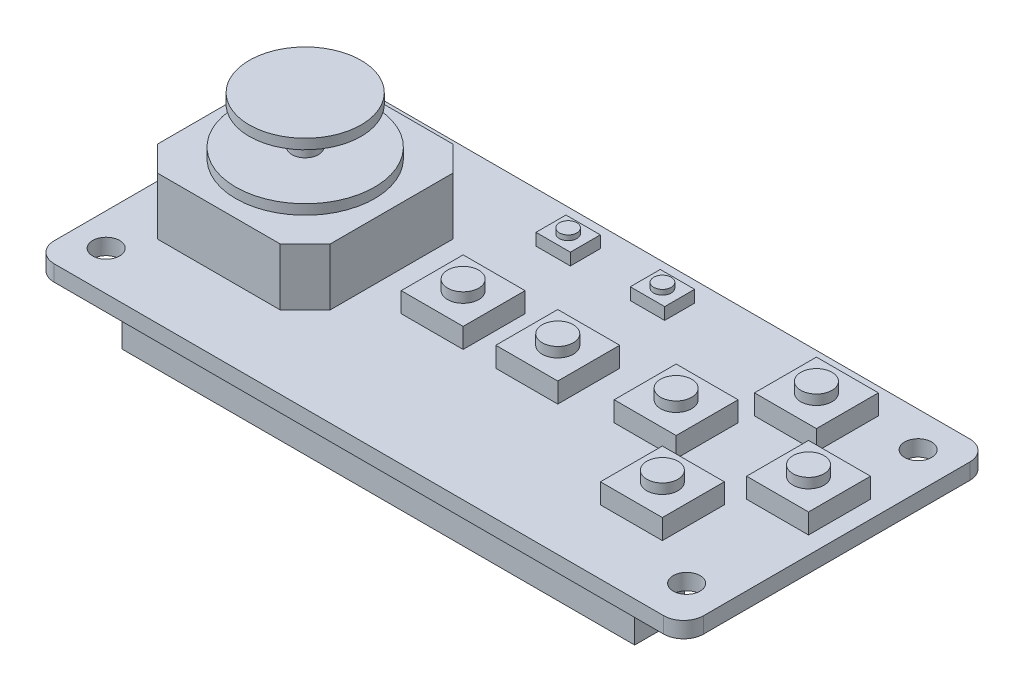
from build123d import *

# Parameters (mm, degrees)
SKETCH_1_W          = 65
SKETCH_1_H          = 30.64
EXTRUDE_1_DEPTH     = 1.6
FILLET_1_R          = 2
SKETCH_2_R          = 1.35
CUT_EXTRUDE_1_DEPTH = 1.6
SKETCH_3_W          = 51.3
SKETCH_3_H          = 5
EXTRUDE_2_DEPTH     = 4
SKETCH_4_W          = 17.3
SKETCH_4_H          = 17.3
EXTRUDE_3_DEPTH     = 5.72
CHAMFER_1_SIZE      = 2.5
SKETCH_5_R          = 6.95
EXTRUDE_4_DEPTH     = 1
SKETCH_6_R          = 1.326147724
EXTRUDE_5_DEPTH     = 3.72
SKETCH_7_R          = 5.6
EXTRUDE_6_DEPTH     = 1
SKETCH_8_W          = 6.2
SKETCH_8_H          = 6.2
EXTRUDE_7_DEPTH     = 2
SKETCH_9_R          = 1.56
EXTRUDE_8_DEPTH     = 1
SKETCH_10_W         = 3.44
SKETCH_10_H         = 3
EXTRUDE_9_DEPTH     = 1.2
SKETCH_11_R         = 0.875
EXTRUDE_10_DEPTH    = 0.5


with BuildPart() as part:
    # 草图1 → 凸台-拉伸1 (new body)
    with BuildSketch(Plane(origin=(0, 0, 0), x_dir=(1, 0, 0), z_dir=(0, 1, 0))):
        with Locations((-2.796247961, 2.767463295)):
            Rectangle(SKETCH_1_W, SKETCH_1_H)
    extrude(amount=EXTRUDE_1_DEPTH)

    # 圆角1
    fillet_1_edges = [part.edges().sort_by_distance(p)[0] for p in [
        (-35.296247961, 0.8, -18.087463295),
        (-35.296247961, 0.8, 12.552536705),
        (29.703752039, 0.8, -18.087463295),
        (29.703752039, 0.8, 12.552536705),
    ]]
    fillet(fillet_1_edges, radius=FILLET_1_R)

    # 草图2 → 切除-拉伸1 (cut)
    with BuildSketch(Plane(origin=(0, 1.6, 0), x_dir=(1, 0, 0), z_dir=(0, 1, 0))):
        with Locations((-32.046247961, 14.567463295)):
            Circle(SKETCH_2_R)
        with Locations((26.053752039, 14.567463295)):
            Circle(SKETCH_2_R)
        with Locations((26.053752039, -8.602536705)):
            Circle(SKETCH_2_R)
        with Locations((-32.046247961, -8.602536705)):
            Circle(SKETCH_2_R)
    extrude(amount=-CUT_EXTRUDE_1_DEPTH, mode=Mode.SUBTRACT)

    # 草图3 → 凸台-拉伸2 (add)
    with BuildSketch(Plane.XZ):
        with Locations((-2.446247961, 8.452536705)):
            Rectangle(SKETCH_3_W, SKETCH_3_H)
    extrude(amount=EXTRUDE_2_DEPTH)

    # 草图4 → 凸台-拉伸3 (add)
    with BuildSketch(Plane(origin=(0, 1.6, 0), x_dir=(1, 0, 0), z_dir=(0, 1, 0))):
        with Locations((-24.136247961, 3.407463295)):
            Rectangle(SKETCH_4_W, SKETCH_4_H)
    extrude(amount=EXTRUDE_3_DEPTH)

    # 倒角1
    chamfer_1_edges = [part.edges().sort_by_distance(p)[0] for p in [
        (-15.486247961, 4.46, -12.057463295),
        (-32.786247961, 4.46, -12.057463295),
        (-32.786247961, 4.46, 5.242536705),
        (-15.486247961, 4.46, 5.242536705),
    ]]
    chamfer(chamfer_1_edges, length=CHAMFER_1_SIZE)

    # 草图5 → 凸台-拉伸4 (add)
    with BuildSketch(Plane(origin=(0, 7.32, 0), x_dir=(1, 0, 0), z_dir=(0, 1, 0))):
        with Locations((-24.136247961, 3.407463295)):
            Circle(SKETCH_5_R)
    extrude(amount=EXTRUDE_4_DEPTH)

    # 草图6 → 凸台-拉伸5 (add)
    with BuildSketch(Plane(origin=(0, 8.32, 0), x_dir=(1, 0, 0), z_dir=(0, 1, 0))):
        with Locations((-24.136247961, 3.407463295)):
            Circle(SKETCH_6_R)
    extrude(amount=EXTRUDE_5_DEPTH)

    # 草图7 → 凸台-拉伸6 (add)
    with BuildSketch(Plane(origin=(0, 12.04, 0), x_dir=(1, 0, 0), z_dir=(0, 1, 0))):
        with Locations((-24.136247961, 3.407463295)):
            Circle(SKETCH_7_R)
    extrude(amount=EXTRUDE_6_DEPTH)

    # 草图8 → 凸台-拉伸7 (add)
    with BuildSketch(Plane(origin=(0, 1.6, 0), x_dir=(1, 0, 0), z_dir=(0, 1, 0))):
        with Locations((-8.506247961, 3.587463295)):
            Rectangle(SKETCH_8_W, SKETCH_8_H)
        with Locations((0.963752039, 3.587463295)):
            Rectangle(SKETCH_8_W, SKETCH_8_H)
        with Locations((11.613752039, 4.787463295)):
            Rectangle(SKETCH_8_W, SKETCH_8_H)
        with Locations((18.033752039, 12.407463295)):
            Rectangle(SKETCH_8_W, SKETCH_8_H)
        with Locations((24.863752039, 4.787463295)):
            Rectangle(SKETCH_8_W, SKETCH_8_H)
        with Locations((18.033752039, -3.012536705)):
            Rectangle(SKETCH_8_W, SKETCH_8_H)
    extrude(amount=EXTRUDE_7_DEPTH)

    # 草图9 → 凸台-拉伸8 (add)
    with BuildSketch(Plane(origin=(0, 3.6, 0), x_dir=(1, 0, 0), z_dir=(0, 1, 0))):
        with Locations((-8.506247961, 3.587463295)):
            Circle(SKETCH_9_R)
        with Locations((0.963752039, 3.587463295)):
            Circle(SKETCH_9_R)
        with Locations((11.613752039, 4.787463295)):
            Circle(SKETCH_9_R)
        with Locations((18.033752039, 12.407463295)):
            Circle(SKETCH_9_R)
        with Locations((24.863752039, 4.787463295)):
            Circle(SKETCH_9_R)
        with Locations((18.033752039, -3.012536705)):
            Circle(SKETCH_9_R)
    extrude(amount=EXTRUDE_8_DEPTH)

    # 草图10 → 凸台-拉伸9 (add)
    with BuildSketch(Plane(origin=(0, 1.6, 0), x_dir=(1, 0, 0), z_dir=(0, 1, 0))):
        with Locations((-8.996247961, 14.587463295)):
            Rectangle(SKETCH_10_W, SKETCH_10_H)
        with Locations((0.443752039, 14.587463295)):
            Rectangle(SKETCH_10_W, SKETCH_10_H)
    extrude(amount=EXTRUDE_9_DEPTH)

    # 草图11 → 凸台-拉伸10 (add)
    with BuildSketch(Plane(origin=(0, 2.8, 0), x_dir=(1, 0, 0), z_dir=(0, 1, 0))):
        with Locations((-8.996247961, 14.587463295)):
            Circle(SKETCH_11_R)
        with Locations((0.443752039, 14.587463295)):
            Circle(SKETCH_11_R)
    extrude(amount=EXTRUDE_10_DEPTH)


solid = part.part
